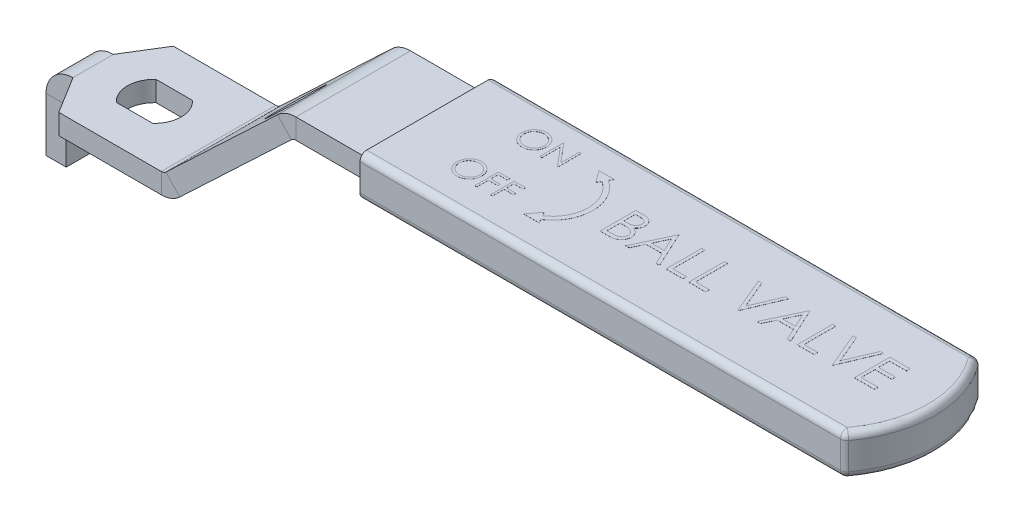
from build123d import *

# Parameters (mm, degrees)
BASE_FLANGE1_DEPTH  = 8.5
CUT_EXTRUDE1_DEPTH  = 119.863864273
SKETCH9_R           = 3.75
CUT_EXTRUDE2_DEPTH  = 135.74974064
BOSS_EXTRUDE1_DEPTH = 3
FILLET1_R           = 1
CUT_EXTRUDE3_DEPTH  = 124.020647419
BOSS_EXTRUDE2_DEPTH = 0.01


# Sheet-metal steps are written as plain solids
with BuildPart() as part:
    # Sketch5 → Base-Flange1 (new, symmetric)
    with BuildSketch(Plane.XY):
        with BuildLine():
            Line((117.334429005, 52.695), (34.924743548, 52.695))
            ThreePointArc((34.924743548, 52.695), (33.446942892, 52.412002182), (32.178249416, 51.60305261))
            Line((32.178249416, 51.60305261), (15.623473902, 35.967986847))
            ThreePointArc((15.623473902, 35.967986847), (15.306300534, 35.765749455), (14.93685037, 35.695))
            Line((14.93685037, 35.695), (-3.665570995, 35.695))
            ThreePointArc((-3.665570995, 35.695), (-6.49399812, 34.523427125), (-7.665570995, 31.695))
            Line((-7.665570995, 31.695), (-7.665570995, 23.695))
            Line((-7.665570995, 23.695), (-4.665570995, 23.695))
            Line((-4.665570995, 23.695), (-4.665570995, 31.695))
            ThreePointArc((-4.665570995, 31.695), (-4.372677776, 32.402106781), (-3.665570995, 32.695))
            Line((-3.665570995, 32.695), (14.93685037, 32.695))
            ThreePointArc((14.93685037, 32.695), (16.414651026, 32.977997818), (17.683344501, 33.78694739))
            Line((17.683344501, 33.78694739), (34.238120015, 49.422013153))
            ThreePointArc((34.238120015, 49.422013153), (34.555293384, 49.624250545), (34.924743548, 49.695))
            Line((34.924743548, 49.695), (117.334429005, 49.695))
            Line((117.334429005, 49.695), (117.334429005, 52.695))
        make_face()
    extrude(amount=BASE_FLANGE1_DEPTH, both=True)

    # Sketch8 → Cut-Extrude1 (cut, through all)
    with BuildSketch(Plane(origin=(0, 35.695, 0), x_dir=(1, 0, 0), z_dir=(0, 1, 0))):
        Polygon((-3.665570995, 3), (-8.383485137, 3), (-8.383485137, 8.5), (-0.269913787, 8.5), align=None)
        Polygon((-3.665570995, -3), (-8.383485137, -3), (-8.383485137, -8.5), (-0.269913787, -8.5), align=None)
    extrude(amount=-CUT_EXTRUDE1_DEPTH, mode=Mode.SUBTRACT)

    # Sketch9 → Cut-Extrude2 (cut, through all)
    with BuildSketch(Plane(origin=(-10.58893967, 11.211818474, 0), x_dir=(0.7270131525498175, 0.6866235329637166, 0), z_dir=(-0.6866235329637166, 0.7270131525498175, 0))):
        with Locations(Location((50.825880846, 0, 0), (0, 0, 180))):
            Circle(SKETCH9_R)
    extrude(amount=-CUT_EXTRUDE2_DEPTH, mode=Mode.SUBTRACT)

    # Sketch10 → Boss-Extrude1 (add, symmetric)
    with BuildSketch(Plane(origin=(0, 51.195, 0), x_dir=(1, 0, 0), z_dir=(0, 1, 0))):
        with BuildLine():
            Line((117.699853944, 10), (45.924743548, 10))
            Line((45.924743548, 10), (45.924743548, -10))
            Line((45.924743548, -10), (117.699853944, -10))
            ThreePointArc((117.699853944, -10), (121.209857947, 0), (117.699853944, 10))
        make_face()
    extrude(amount=BOSS_EXTRUDE1_DEPTH, both=True)

    # Fillet1
    fillet1_edges = [part.edges().sort_by_distance(p)[0] for p in [
        (121.209857947, 48.195, 0),
        (117.699853944, 51.195, 10),
        (81.812298746, 48.195, -10),
        (117.699853944, 51.195, -10),
        (45.924743548, 51.195, -10),
        (81.812298746, 54.195, 10),
        (121.209857947, 54.195, 0),
        (81.812298746, 54.195, -10),
        (81.812298746, 48.195, 10),
    ]]
    fillet(fillet1_edges, radius=FILLET1_R)

    # Sketch11 → Cut-Extrude3 (cut, through all)
    with BuildSketch(Plane(origin=(0, 35.695, 0), x_dir=(1, 0, 0), z_dir=(0, 1, 0))):
        with BuildLine():
            Line((2.71317371, 2.95), (8.115950773, 2.95))
            ThreePointArc((8.115950773, 2.95), (9.414562241, 0), (8.115950773, -2.95))
            Line((8.115950773, -2.95), (2.71317371, -2.95))
            ThreePointArc((2.71317371, -2.95), (1.414562241, 0), (2.71317371, 2.95))
        make_face()
    extrude(amount=-CUT_EXTRUDE3_DEPTH, mode=Mode.SUBTRACT)

    # Sketch12 → Boss-Extrude2 (add)
    # profile 1 of 15: a face of its own
    with BuildSketch(Plane(origin=(0, 54.195, 0), x_dir=(1, 0, 0), z_dir=(0, 1, 0))):
        with BuildLine():
            Line((67.09539703, 3.842426436), (67.420480273, 4.405487131))
            ThreePointArc((67.420480273, 4.405487131), (69.787084896, 0), (67.420480273, -4.405487131))
            Line((67.420480273, -4.405487131), (67.09539703, -3.842426436))
            Line((67.09539703, -3.842426436), (65.785995953, -5.574477244))
            Line((65.785995953, -5.574477244), (68.09539703, -5.574477244))
            Line((68.09539703, -5.574477244), (67.770313786, -5.011416549))
            ThreePointArc((67.770313786, -5.011416549), (70.485592084, 0), (67.770313786, 5.011416549))
            Line((67.770313786, 5.011416549), (68.09539703, 5.574477244))
            Line((68.09539703, 5.574477244), (65.785995953, 5.574477244))
            Line((65.785995953, 5.574477244), (67.09539703, 3.842426436))
        make_face()
    # profile 2 of 15: a face of its own
    with BuildSketch(Plane(origin=(0, 54.195, 0), x_dir=(1, 0, 0), z_dir=(0, 1, 0))):
        Polygon((59.604642791, 2.990312766), (59.604642791, 6.490312766), (59.67054824, 6.490312766), (61.98284792, 3.735605234), (61.98284792, 6.490312766), (62.296950484, 6.490312766), (62.296950484, 2.990312766), (62.225436061, 2.990312766), (59.918745356, 5.738710202), (59.918745356, 2.990312766), align=None)
    # profile 3 of 15: a face of its own
    with BuildSketch(Plane(origin=(0, 54.195, 0), x_dir=(1, 0, 0), z_dir=(0, 1, 0))):
        with BuildLine():
            add(Edge.make_bspline(
                [(57.024514586, 6.580056356), (57.089322692, 6.578414877), (57.216611159, 6.575190876), (57.403686057, 6.550511772), (57.582281152, 6.507816382), (57.753851291, 6.4509534), (57.916344268, 6.375099014), (58.07098316, 6.283413866), (58.217400034, 6.174937407), (58.353621415, 6.05050818), (58.478278366, 5.915124726), (58.588104252, 5.770646816), (58.680146546, 5.617948014), (58.755732333, 5.457487183), (58.815030943, 5.289627215), (58.855949986, 5.113473213), (58.882088136, 4.930166523), (58.885143914, 4.805139658), (58.886694074, 4.74171501)],
                knots=[0, 0, 0, 0, 1.065120563, 2.091984664, 3.0946048, 4.079830382, 5.057816894, 6.036188127, 7.030412546, 8.04752943, 9.064399622, 10.05169764, 11.02544977, 11.989514704, 12.962713494, 13.945757189, 14.957906945, 16, 16, 16, 16], degree=3))
            add(Edge.make_bspline(
                [(58.886694074, 4.74171501), (58.885144141, 4.678757563), (58.882089044, 4.554661143), (58.855920267, 4.372517699), (58.814879267, 4.197427002), (58.756283001, 4.02968135), (58.681057522, 3.869103786), (58.588402351, 3.716116832), (58.47926114, 3.570670333), (58.355054289, 3.434357668), (58.219653247, 3.309360198), (58.074422981, 3.200441322), (57.922629661, 3.106717197), (57.762319952, 3.031933523), (57.595619916, 2.972161603), (57.421037593, 2.931408973), (57.239391039, 2.90512193), (57.115520035, 2.902103414), (57.052559458, 2.900569176)],
                knots=[0, 0, 0, 0, 1.043624062, 2.057103931, 3.04512605, 4.022047818, 4.998200453, 5.980619268, 6.982898556, 8.009068085, 9.034988726, 10.034168286, 11.015286542, 11.987931943, 12.962482838, 13.94673481, 14.956375938, 16, 16, 16, 16], degree=3))
            add(Edge.make_bspline(
                [(57.052559458, 2.900569176), (56.989135139, 2.902118563), (56.864108923, 2.905172817), (56.680571888, 2.931354222), (56.504294144, 2.972295526), (56.335779793, 3.030804962), (56.174934863, 3.106422193), (56.021444781, 3.198626572), (55.875925633, 3.308033713), (55.739583887, 3.432200288), (55.614834689, 3.56737184), (55.506075313, 3.712206095), (55.4138502, 3.863861551), (55.338486867, 4.022759075), (55.278822408, 4.188130518), (55.23811759, 4.361078996), (55.211781638, 4.540618501), (55.208746791, 4.6628614), (55.207206894, 4.724888087)],
                knots=[0, 0, 0, 0, 1.053102029, 2.075944431, 3.073151272, 4.055350789, 5.033113405, 6.020478099, 7.024410459, 8.052272461, 9.079885166, 10.07527673, 11.055994387, 12.023226415, 12.992069828, 13.970394897, 14.97016774, 16, 16, 16, 16], degree=3))
            add(Edge.make_bspline(
                [(55.207206894, 4.724888087), (55.20774153, 4.766520756), (55.208804056, 4.849260879), (55.221595748, 4.972127479), (55.24015745, 5.093018137), (55.266759362, 5.211589085), (55.301551029, 5.32755007), (55.342603057, 5.441700833), (55.392742902, 5.552884556), (55.44942355, 5.661627948), (55.512685358, 5.766235854), (55.582561107, 5.865115437), (55.656596476, 5.959096434), (55.737759869, 6.045743438), (55.823376315, 6.127577094), (55.914834693, 6.203339811), (56.011576937, 6.273714762), (56.114019317, 6.337135103), (56.219637592, 6.394494238), (56.32851437, 6.443716089), (56.439170941, 6.48596215), (56.552125589, 6.520202976), (56.667078361, 6.547235012), (56.784280146, 6.565642365), (56.903637572, 6.578466683), (56.984048891, 6.579524185), (57.024514586, 6.580056356)],
                knots=[0, 0, 0, 0, 1.037015668, 2.060948919, 3.074880161, 4.083647147, 5.086022904, 6.090072063, 7.104153813, 8.122640571, 9.144368836, 10.147691507, 11.138137339, 12.123020368, 13.103399296, 14.087645067, 15.080126199, 16.082011238, 17.087798457, 18.072939717, 19.057185487, 20.037253025, 21.01195951, 21.997135196, 22.992090687, 24, 24, 24, 24], degree=3))
        make_face()
        with BuildLine():
            add(Edge.make_bspline(
                [(57.039939266, 6.221081997), (57.006724632, 6.220677107), (56.940612899, 6.219871197), (56.842328363, 6.209255481), (56.745336429, 6.194125592), (56.649617067, 6.172544072), (56.555570778, 6.143140019), (56.462320937, 6.109299111), (56.370717883, 6.06807802), (56.281064025, 6.021505316), (56.19414895, 5.969956395), (56.112136248, 5.912984628), (56.034813604, 5.851926074), (55.962370338, 5.786638236), (55.895019165, 5.716788634), (55.831434464, 5.643436198), (55.774164882, 5.564484307), (55.721679306, 5.4820739), (55.674711465, 5.396312319), (55.632946111, 5.308102457), (55.598782102, 5.21672477), (55.570919725, 5.123170613), (55.547819915, 5.027588153), (55.53318599, 4.929252304), (55.522453631, 4.828657192), (55.521693786, 4.760675338), (55.521309458, 4.72629033)],
                knots=[0, 0, 0, 0, 1.008559885, 2.007477868, 2.99961109, 3.989939068, 4.984837346, 5.991145699, 7.001802488, 8.033829008, 9.059044045, 10.069351652, 11.065060232, 12.050310815, 13.029377138, 14.011219647, 14.996725999, 15.989392538, 16.977580475, 17.965360261, 18.951710183, 19.937753436, 20.929683414, 21.935841486, 22.955955122, 24, 24, 24, 24], degree=3))
            add(Edge.make_bspline(
                [(55.521309458, 4.72629033), (55.52258432, 4.675728109), (55.525092368, 4.576256579), (55.547049938, 4.430488435), (55.580871913, 4.290400149), (55.630729279, 4.15675824), (55.693079894, 4.028413957), (55.770106784, 3.906505852), (55.861365869, 3.791000978), (55.965029396, 3.682705709), (56.078352103, 3.583859905), (56.198684833, 3.497096496), (56.32473844, 3.423686246), (56.456841643, 3.363881174), (56.594289182, 3.316491436), (56.737966733, 3.284012805), (56.886917192, 3.262637349), (56.988447848, 3.260584593), (57.039939266, 3.259543535)],
                knots=[0, 0, 0, 0, 1.032063989, 2.030389145, 3.003944642, 3.970395727, 4.937377036, 5.913328081, 6.909231446, 7.93887556, 8.970685674, 9.976071282, 10.964166581, 11.944589148, 12.933237628, 13.927779006, 14.949070134, 16, 16, 16, 16], degree=3))
            add(Edge.make_bspline(
                [(57.039939266, 3.259543535), (57.074548767, 3.26001904), (57.143189804, 3.260962108), (57.245285326, 3.270460785), (57.345541538, 3.285692654), (57.443817818, 3.30762331), (57.540002629, 3.335070516), (57.634497432, 3.367678244), (57.726295723, 3.408359448), (57.81655556, 3.453307399), (57.902951802, 3.504547557), (57.985427334, 3.559585706), (58.061903314, 3.620554327), (58.134292386, 3.68487214), (58.201920075, 3.753835988), (58.264329059, 3.827356209), (58.321309191, 3.905896867), (58.373774838, 3.988182272), (58.4205781, 4.074178525), (58.461357199, 4.162708203), (58.495953315, 4.253553312), (58.52388182, 4.346844884), (58.545767282, 4.442405733), (58.560847202, 4.540363811), (58.57139564, 4.640523153), (58.572190718, 4.708267009), (58.572591509, 4.742416132)],
                knots=[0, 0, 0, 0, 1.047197238, 2.076906641, 3.100256066, 4.114471768, 5.12198147, 6.126382909, 7.136867548, 8.15857795, 9.17633901, 10.174870724, 11.156907918, 12.133735059, 13.104061851, 14.077631395, 15.04955518, 16.038496417, 17.029181396, 18.010275684, 18.986308667, 19.968651475, 20.955262928, 21.950658345, 22.966943676, 24, 24, 24, 24], degree=3))
            add(Edge.make_bspline(
                [(58.572591509, 4.742416132), (58.572190396, 4.776331636), (58.571394715, 4.843609286), (58.56085224, 4.943070104), (58.54575135, 5.040323316), (58.523988642, 5.134987119), (58.495938488, 5.227085644), (58.461351158, 5.316532392), (58.420565858, 5.403660587), (58.373757634, 5.488254884), (58.32114181, 5.569429622), (58.263647567, 5.647032034), (58.200282219, 5.719604775), (58.132856194, 5.78893947), (58.059685309, 5.853557359), (57.981101015, 5.91347988), (57.898057337, 5.970153154), (57.810130102, 6.021278716), (57.719386148, 6.068492949), (57.62627219, 6.108943952), (57.53184309, 6.143316071), (57.436338978, 6.172633036), (57.338956, 6.194041066), (57.240352171, 6.209269116), (57.140663912, 6.219867502), (57.073620692, 6.220675881), (57.039939266, 6.221081997)],
                knots=[0, 0, 0, 0, 1.02996197, 2.043119294, 3.035359645, 4.018872909, 4.991431989, 5.957985074, 6.929999688, 7.912076566, 8.892894881, 9.867085534, 10.843653904, 11.817741046, 12.803660682, 13.806313499, 14.818574707, 15.856120519, 16.894564902, 17.924820532, 18.937903209, 19.946497019, 20.957711757, 21.963978472, 22.977135795, 24, 24, 24, 24], degree=3))
        make_face(mode=Mode.SUBTRACT)
    # profile 4 of 15: a face of its own
    with BuildSketch(Plane(origin=(0, 54.195, 0), x_dir=(1, 0, 0), z_dir=(0, 1, 0))):
        Polygon((60.861053048, -2.074477244), (62.566181253, -2.074477244), (62.566181253, -2.433451603), (61.175155612, -2.433451603), (61.175155612, -3.51037468), (62.566181253, -3.51037468), (62.566181253, -3.869349039), (61.175155612, -3.869349039), (61.175155612, -5.574477244), (60.861053048, -5.574477244), align=None)
    # profile 5 of 15: a face of its own
    with BuildSketch(Plane(origin=(0, 54.195, 0), x_dir=(1, 0, 0), z_dir=(0, 1, 0))):
        Polygon((58.527719715, -2.074477244), (60.23284792, -2.074477244), (60.23284792, -2.433451603), (58.841822279, -2.433451603), (58.841822279, -3.51037468), (60.23284792, -3.51037468), (60.23284792, -3.869349039), (58.841822279, -3.869349039), (58.841822279, -5.574477244), (58.527719715, -5.574477244), align=None)
    # profile 6 of 15: a face of its own
    with BuildSketch(Plane(origin=(0, 54.195, 0), x_dir=(1, 0, 0), z_dir=(0, 1, 0))):
        with BuildLine():
            add(Edge.make_bspline(
                [(55.947591509, -1.984733654), (56.012399615, -1.986375133), (56.139688082, -1.989599134), (56.32676298, -2.014278238), (56.505358075, -2.056973628), (56.676928214, -2.11383661), (56.839421191, -2.189690996), (56.994060083, -2.281376144), (57.140476957, -2.389852603), (57.276698339, -2.51428183), (57.401355289, -2.649665283), (57.511181175, -2.794143194), (57.603223469, -2.946841996), (57.678809256, -3.107302826), (57.738107866, -3.275162794), (57.779026909, -3.451316797), (57.80516506, -3.634623487), (57.808220837, -3.759650352), (57.809770997, -3.823075)],
                knots=[0, 0, 0, 0, 1.065120563, 2.091984664, 3.0946048, 4.079830382, 5.057816894, 6.036188127, 7.030412546, 8.04752943, 9.064399622, 10.05169764, 11.02544977, 11.989514704, 12.962713494, 13.945757189, 14.957906945, 16, 16, 16, 16], degree=3))
            add(Edge.make_bspline(
                [(57.809770997, -3.823075), (57.808221064, -3.886032446), (57.805165968, -4.010128867), (57.77899719, -4.192272311), (57.73795619, -4.367363008), (57.679359924, -4.53510866), (57.604134445, -4.695686224), (57.511479274, -4.848673178), (57.402338063, -4.994119676), (57.278131212, -5.130432342), (57.14273017, -5.255429812), (56.997499904, -5.364348688), (56.845706584, -5.458072813), (56.685396876, -5.532856486), (56.518696839, -5.592628407), (56.344114516, -5.633381037), (56.162467962, -5.65966808), (56.038596958, -5.662686596), (55.975636381, -5.664220833)],
                knots=[0, 0, 0, 0, 1.043624062, 2.057103931, 3.04512605, 4.022047818, 4.998200453, 5.980619268, 6.982898556, 8.009068085, 9.034988726, 10.034168286, 11.015286542, 11.987931943, 12.962482838, 13.94673481, 14.956375938, 16, 16, 16, 16], degree=3))
            add(Edge.make_bspline(
                [(55.975636381, -5.664220833), (55.912212062, -5.662671447), (55.787185846, -5.659617193), (55.603648811, -5.633435788), (55.427371067, -5.592494484), (55.258856716, -5.533985048), (55.098011786, -5.458367817), (54.944521704, -5.366163438), (54.799002556, -5.256756297), (54.66266081, -5.132589722), (54.537911612, -4.99741817), (54.429152236, -4.852583915), (54.336927123, -4.700928459), (54.26156379, -4.542030934), (54.201899331, -4.376659492), (54.161194513, -4.203711014), (54.134858561, -4.024171508), (54.131823714, -3.90192861), (54.130283817, -3.839901923)],
                knots=[0, 0, 0, 0, 1.053102029, 2.075944431, 3.073151272, 4.055350789, 5.033113405, 6.020478099, 7.024410459, 8.052272461, 9.079885166, 10.07527673, 11.055994387, 12.023226415, 12.992069828, 13.970394897, 14.97016774, 16, 16, 16, 16], degree=3))
            add(Edge.make_bspline(
                [(54.130283817, -3.839901923), (54.130818453, -3.798269254), (54.131880979, -3.715529131), (54.144672671, -3.59266253), (54.163234373, -3.471771873), (54.189836285, -3.353200925), (54.224627952, -3.23723994), (54.26567998, -3.123089177), (54.315819825, -3.011905453), (54.372500473, -2.903162062), (54.435762281, -2.798554156), (54.50563803, -2.699674573), (54.579673399, -2.605693576), (54.660836793, -2.519046572), (54.746453238, -2.437212916), (54.837911616, -2.361450199), (54.93465386, -2.291075248), (55.03709624, -2.227654907), (55.142714515, -2.170295772), (55.251591293, -2.121073921), (55.362247864, -2.078827859), (55.475202512, -2.044587034), (55.590155284, -2.017554998), (55.707357069, -1.999147645), (55.826714495, -1.986323327), (55.907125814, -1.985265825), (55.947591509, -1.984733654)],
                knots=[0, 0, 0, 0, 1.037015668, 2.060948919, 3.074880161, 4.083647147, 5.086022904, 6.090072063, 7.104153813, 8.122640571, 9.144368836, 10.147691507, 11.138137339, 12.123020368, 13.103399296, 14.087645067, 15.080126199, 16.082011238, 17.087798457, 18.072939717, 19.057185487, 20.037253025, 21.01195951, 21.997135196, 22.992090687, 24, 24, 24, 24], degree=3))
        make_face()
        with BuildLine():
            add(Edge.make_bspline(
                [(55.963016189, -2.343708013), (55.929801555, -2.344112903), (55.863689822, -2.344918813), (55.765405286, -2.355534528), (55.668413352, -2.370664417), (55.57269399, -2.392245938), (55.478647701, -2.421649991), (55.38539786, -2.455490899), (55.293794806, -2.49671199), (55.204140948, -2.543284694), (55.117225873, -2.594833615), (55.035213171, -2.651805382), (54.957890527, -2.712863936), (54.885447261, -2.778151774), (54.818096089, -2.848001375), (54.754511387, -2.921353811), (54.697241805, -3.000305703), (54.644756229, -3.082716109), (54.597788388, -3.168477691), (54.556023034, -3.256687553), (54.521859025, -3.34806524), (54.493996649, -3.441619397), (54.470896838, -3.537201857), (54.456262914, -3.635537706), (54.445530554, -3.736132818), (54.444770709, -3.804114672), (54.444386381, -3.83849968)],
                knots=[0, 0, 0, 0, 1.008559885, 2.007477868, 2.99961109, 3.989939068, 4.984837346, 5.991145699, 7.001802488, 8.033829008, 9.059044045, 10.069351652, 11.065060232, 12.050310815, 13.029377138, 14.011219647, 14.996725999, 15.989392538, 16.977580475, 17.965360261, 18.951710183, 19.937753436, 20.929683414, 21.935841486, 22.955955122, 24, 24, 24, 24], degree=3))
            add(Edge.make_bspline(
                [(54.444386381, -3.83849968), (54.445661243, -3.8890619), (54.448169291, -3.988533431), (54.470126861, -4.134301575), (54.503948836, -4.274389861), (54.553806202, -4.40803177), (54.616156817, -4.536376053), (54.693183707, -4.658284158), (54.784442793, -4.773789032), (54.888106319, -4.882084301), (55.001429026, -4.980930105), (55.121761756, -5.067693514), (55.247815363, -5.141103764), (55.379918566, -5.200908836), (55.517366105, -5.248298574), (55.661043656, -5.280777205), (55.809994116, -5.30215266), (55.911524771, -5.304205416), (55.963016189, -5.305246474)],
                knots=[0, 0, 0, 0, 1.032063989, 2.030389145, 3.003944642, 3.970395727, 4.937377036, 5.913328081, 6.909231446, 7.93887556, 8.970685674, 9.976071282, 10.964166581, 11.944589148, 12.933237628, 13.927779006, 14.949070134, 16, 16, 16, 16], degree=3))
            add(Edge.make_bspline(
                [(55.963016189, -5.305246474), (55.997625691, -5.30477097), (56.066266727, -5.303827902), (56.168362249, -5.294329225), (56.268618461, -5.279097356), (56.366894741, -5.2571667), (56.463079552, -5.229719494), (56.557574355, -5.197111766), (56.649372646, -5.156430562), (56.739632483, -5.111482611), (56.826028725, -5.060242453), (56.908504257, -5.005204303), (56.984980237, -4.944235683), (57.057369309, -4.87991787), (57.124996998, -4.810954022), (57.187405982, -4.7374338), (57.244386114, -4.658893143), (57.296851761, -4.576607737), (57.343655023, -4.490611485), (57.384434123, -4.402081807), (57.419030238, -4.311236697), (57.446958743, -4.217945126), (57.468844205, -4.122384277), (57.483924125, -4.024426199), (57.494472563, -3.924266857), (57.495267641, -3.856523001), (57.495668433, -3.822373878)],
                knots=[0, 0, 0, 0, 1.047197238, 2.076906641, 3.100256066, 4.114471768, 5.12198147, 6.126382909, 7.136867548, 8.15857795, 9.17633901, 10.174870724, 11.156907918, 12.133735059, 13.104061851, 14.077631395, 15.04955518, 16.038496417, 17.029181396, 18.010275684, 18.986308667, 19.968651475, 20.955262928, 21.950658345, 22.966943676, 24, 24, 24, 24], degree=3))
            add(Edge.make_bspline(
                [(57.495668433, -3.822373878), (57.49526732, -3.788458374), (57.494471638, -3.721180724), (57.483929163, -3.621719905), (57.468828273, -3.524466694), (57.447065565, -3.429802891), (57.419015411, -3.337704366), (57.384428081, -3.248257618), (57.343642781, -3.161129423), (57.296834557, -3.076535126), (57.244218734, -2.995360388), (57.18672449, -2.917757976), (57.123359142, -2.845185234), (57.055933117, -2.77585054), (56.982762232, -2.711232651), (56.904177938, -2.65131013), (56.82113426, -2.594636856), (56.733207025, -2.543511294), (56.642463071, -2.496297061), (56.549349113, -2.455846058), (56.454920013, -2.421473939), (56.359415901, -2.392156974), (56.262032923, -2.370748943), (56.163429094, -2.355520894), (56.063740835, -2.344922508), (55.996697616, -2.344114129), (55.963016189, -2.343708013)],
                knots=[0, 0, 0, 0, 1.02996197, 2.043119294, 3.035359645, 4.018872909, 4.991431989, 5.957985074, 6.929999688, 7.912076566, 8.892894881, 9.867085534, 10.843653904, 11.817741046, 12.803660682, 13.806313499, 14.818574707, 15.856120519, 16.894564902, 17.924820532, 18.937903209, 19.946497019, 20.957711757, 21.963978472, 22.977135795, 24, 24, 24, 24], degree=3))
        make_face(mode=Mode.SUBTRACT)
    # profile 7 of 15: a face of its own
    with BuildSketch(Plane(origin=(0, 54.195, 0), x_dir=(1, 0, 0), z_dir=(0, 1, 0))):
        with BuildLine():
            Line((73.646704596, 3.200636404), (74.679173212, 3.200636404))
            add(Edge.make_bspline(
                [(74.679173212, 3.200636404), (74.729713887, 3.200370686), (74.827674295, 3.199855659), (74.970125117, 3.191868068), (75.103548914, 3.180976805), (75.22798438, 3.163695593), (75.343374013, 3.14284374), (75.45006556, 3.117592185), (75.547719749, 3.087313852), (75.664306862, 3.039165308), (75.797234528, 2.967617184), (75.941165431, 2.861891854), (76.064240889, 2.732574915), (76.170355916, 2.586702329), (76.254721894, 2.42623515), (76.315756427, 2.254998044), (76.354397501, 2.075199696), (76.358371443, 1.951762986), (76.360379809, 1.889380061)],
                knots=[0, 0, 0, 0, 1.001505555, 1.941167018, 2.826882275, 3.653841531, 4.429895133, 5.150066043, 5.825578002, 6.45369114, 7.647487171, 8.808567382, 9.977351308, 11.170798116, 12.373658725, 13.556498008, 14.765093433, 16, 16, 16, 16], degree=3))
            add(Edge.make_bspline(
                [(76.360379809, 1.889380061), (76.358726967, 1.830941078), (76.355478976, 1.716102965), (76.324420281, 1.548139252), (76.275796413, 1.388253481), (76.208206334, 1.23702916), (76.120361649, 1.097883102), (76.016254429, 0.969692831), (75.890650216, 0.857885875), (75.796544365, 0.795379344), (75.748742857, 0.763628859)],
                knots=[0, 0, 0, 0, 1.044552857, 2.05264487, 3.044412934, 4.028983338, 5.005914585, 5.980388656, 6.974128949, 8, 8, 8, 8], degree=3))
            add(Edge.make_bspline(
                [(75.748742857, 0.763628859), (75.808856837, 0.740549634), (75.923869771, 0.69639336), (76.082145052, 0.618325456), (76.218511068, 0.533413694), (76.334016276, 0.440685778), (76.432800588, 0.340735552), (76.519059202, 0.232097463), (76.592660804, 0.113354341), (76.655726771, -0.014255766), (76.704937391, -0.149429832), (76.741791436, -0.290899934), (76.762908889, -0.438158785), (76.765914014, -0.538375966), (76.767431091, -0.588968631)],
                knots=[0, 0, 0, 0, 1.27268992, 2.434971085, 3.483601985, 4.442670788, 5.356604649, 6.2567628, 7.179492994, 8.113709626, 9.066344395, 10.018646069, 10.999752585, 12, 12, 12, 12], degree=3))
            add(Edge.make_bspline(
                [(76.767431091, -0.588968631), (76.765954193, -0.640625687), (76.763048355, -0.742262394), (76.741609588, -0.891570752), (76.705310105, -1.034256683), (76.655309681, -1.17124309), (76.590052372, -1.30226496), (76.510635092, -1.427470728), (76.415942133, -1.545602395), (76.310013748, -1.657972634), (76.190176933, -1.759009884), (76.060885256, -1.848991965), (75.920510463, -1.922993749), (75.771358043, -1.985157258), (75.611754851, -2.032641951), (75.442417575, -2.06586239), (75.263492262, -2.088246196), (75.140710852, -2.090086494), (75.077744259, -2.091030263)],
                knots=[0, 0, 0, 0, 0.978564426, 1.925352924, 2.850884081, 3.763762016, 4.682927383, 5.618979971, 6.567305752, 7.547517671, 8.540179244, 9.531824382, 10.526200242, 11.540722885, 12.589160233, 13.674978461, 14.80764778, 16, 16, 16, 16], degree=3))
            Line((75.077744259, -2.091030263), (73.646704596, -2.091030263))
            Line((73.646704596, -2.091030263), (73.646704596, 3.200636404))
        make_face()
        with BuildLine():
            Line((74.121597758, 2.657901361), (74.121597758, 0.961854353))
            Line((74.121597758, 0.961854353), (74.440666601, 0.961854353))
            add(Edge.make_bspline(
                [(74.440666601, 0.961854353), (74.487307042, 0.962458998), (74.577425878, 0.963627297), (74.707933341, 0.966973924), (74.829074737, 0.976344775), (74.940640961, 0.985712933), (75.042456323, 1.00094475), (75.134295256, 1.019075698), (75.217599087, 1.038251042), (75.313664829, 1.070862052), (75.422632263, 1.119058061), (75.538796599, 1.193854766), (75.641204666, 1.282942776), (75.727681366, 1.385738635), (75.798455852, 1.498929178), (75.847613492, 1.62070839), (75.880946886, 1.748041209), (75.883957892, 1.8354569), (75.885486647, 1.879839796)],
                knots=[0, 0, 0, 0, 1.156816544, 2.235205308, 3.236616184, 4.169592532, 5.011045266, 5.787822928, 6.49130361, 7.128639758, 8.301311294, 9.436451833, 10.541879658, 11.654887649, 12.756523258, 13.837046038, 14.901820046, 16, 16, 16, 16], degree=3))
            add(Edge.make_bspline(
                [(75.885486647, 1.879839796), (75.884691112, 1.909209713), (75.883130585, 1.966822011), (75.870349997, 2.050807344), (75.848627592, 2.129794922), (75.820726459, 2.204867208), (75.781736417, 2.273676791), (75.735829753, 2.338602813), (75.680364483, 2.39743423), (75.617231403, 2.452421448), (75.544646937, 2.501172103), (75.462654389, 2.543869448), (75.370144449, 2.578251336), (75.268676204, 2.608362662), (75.156687774, 2.62951163), (75.035471485, 2.647130442), (74.904034469, 2.656100183), (74.813100802, 2.657287577), (74.766095621, 2.657901361)],
                knots=[0, 0, 0, 0, 0.91205012, 1.789085906, 2.630437955, 3.453916878, 4.269457761, 5.079663411, 5.91843418, 6.774407191, 7.675494373, 8.627863946, 9.638891023, 10.736472738, 11.911756761, 13.175263542, 14.539845004, 16, 16, 16, 16], degree=3))
            Line((74.766095621, 2.657901361), (74.121597758, 2.657901361))
        make_face(mode=Mode.SUBTRACT)
        with BuildLine():
            Line((74.121597758, 0.41911931), (74.121597758, -1.54829522))
            Line((74.121597758, -1.54829522), (74.797896503, -1.54829522))
            add(Edge.make_bspline(
                [(74.797896503, -1.54829522), (74.846306069, -1.54771503), (74.939609127, -1.546596792), (75.074321701, -1.542946215), (75.199179489, -1.534642417), (75.313612742, -1.521570716), (75.418857116, -1.507391394), (75.513650072, -1.488324338), (75.598760019, -1.466478886), (75.697448556, -1.432711745), (75.80857886, -1.380253985), (75.928338131, -1.301159857), (76.034815866, -1.206932951), (76.125235722, -1.097877879), (76.199338693, -0.979297182), (76.253246345, -0.853589332), (76.286494426, -0.722831451), (76.290519373, -0.633679397), (76.292537929, -0.588968631)],
                knots=[0, 0, 0, 0, 1.160039823, 2.235823828, 3.228722157, 4.157150951, 4.99529583, 5.772374946, 6.472645482, 7.099169577, 8.269452708, 9.405989375, 10.527446681, 11.663510218, 12.788923519, 13.866172445, 14.929861265, 16, 16, 16, 16], degree=3))
            add(Edge.make_bspline(
                [(76.292537929, -0.588968631), (76.292120485, -0.561008461), (76.291292332, -0.505539122), (76.278803069, -0.424023538), (76.260639242, -0.345062992), (76.237157193, -0.268443074), (76.202958713, -0.195549041), (76.163034532, -0.124939219), (76.116223841, -0.056520268), (76.043283257, 0.02997921), (75.9371899, 0.129639456), (75.786442751, 0.227214013), (75.615034634, 0.305905341), (75.490714496, 0.339317644), (75.426493925, 0.356577577)],
                knots=[0, 0, 0, 0, 0.723448775, 1.435228256, 2.130040452, 2.821711965, 3.505591119, 4.210454504, 4.921174351, 5.648778258, 7.137944449, 8.670945889, 10.280296675, 12, 12, 12, 12], degree=3))
            add(Edge.make_bspline(
                [(75.426493925, 0.356577577), (75.400747554, 0.361801334), (75.344924111, 0.373127519), (75.253895983, 0.385083213), (75.149973896, 0.395734673), (75.032917879, 0.403613447), (74.902579834, 0.411757388), (74.758681397, 0.414924558), (74.601810219, 0.418703201), (74.492964608, 0.418977059), (74.436426484, 0.41911931)],
                knots=[0, 0, 0, 0, 0.634451884, 1.375622551, 2.216452059, 3.157844607, 4.20941857, 5.370758133, 6.634282058, 8, 8, 8, 8], degree=3))
            Line((74.436426484, 0.41911931), (74.121597758, 0.41911931))
        make_face(mode=Mode.SUBTRACT)
    # profile 8 of 15: a face of its own
    with BuildSketch(Plane(origin=(0, 54.195, 0), x_dir=(1, 0, 0), z_dir=(0, 1, 0))):
        Polygon((80.023841348, 3.200636404), (82.46614904, -2.091030263), (81.949914732, -2.091030263), (81.167613049, -0.394983254), (78.768766561, -0.394983254), (77.964204262, -2.091030263), (77.445849895, -2.091030263), (79.955999467, 3.200636404), align=None)
        Polygon((79.984620261, 2.169227817), (79.026353701, 0.147751789), (80.917446115, 0.147751789), align=None, mode=Mode.SUBTRACT)
    # profile 9 of 15: a face of its own
    with BuildSketch(Plane(origin=(0, 54.195, 0), x_dir=(1, 0, 0), z_dir=(0, 1, 0))):
        Polygon((83.415935365, 3.200636404), (83.890828527, 3.200636404), (83.890828527, -1.54829522), (85.926084937, -1.54829522), (85.926084937, -2.091030263), (83.415935365, -2.091030263), align=None)
    # profile 10 of 15: a face of its own
    with BuildSketch(Plane(origin=(0, 54.195, 0), x_dir=(1, 0, 0), z_dir=(0, 1, 0))):
        Polygon((86.808029382, 3.200636404), (87.282922544, 3.200636404), (87.282922544, -1.54829522), (89.318178955, -1.54829522), (89.318178955, -2.091030263), (86.808029382, -2.091030263), align=None)
    # profile 11 of 15: a face of its own
    with BuildSketch(Plane(origin=(0, 54.195, 0), x_dir=(1, 0, 0), z_dir=(0, 1, 0))):
        Polygon((91.828328527, 3.200636404), (92.33714263, 3.200636404), (94.101031519, -0.969519178), (95.864920407, 3.200636404), (96.37373451, 3.200636404), (94.134952459, -2.091030263), (94.067110578, -2.091030263), align=None)
    # profile 12 of 15: a face of its own
    with BuildSketch(Plane(origin=(0, 54.195, 0), x_dir=(1, 0, 0), z_dir=(0, 1, 0))):
        Polygon((99.494461006, 3.200636404), (101.936768698, -2.091030263), (101.42053439, -2.091030263), (100.638232707, -0.394983254), (98.239386219, -0.394983254), (97.43482392, -2.091030263), (96.916469553, -2.091030263), (99.426619125, 3.200636404), align=None)
        Polygon((99.455239919, 2.169227817), (98.496973359, 0.147751789), (100.388065773, 0.147751789), align=None, mode=Mode.SUBTRACT)
    # profile 13 of 15: a face of its own
    with BuildSketch(Plane(origin=(0, 54.195, 0), x_dir=(1, 0, 0), z_dir=(0, 1, 0))):
        Polygon((102.886555023, 3.200636404), (103.361448185, 3.200636404), (103.361448185, -1.54829522), (105.396704596, -1.54829522), (105.396704596, -2.091030263), (102.886555023, -2.091030263), align=None)
    # profile 14 of 15: a face of its own
    with BuildSketch(Plane(origin=(0, 54.195, 0), x_dir=(1, 0, 0), z_dir=(0, 1, 0))):
        Polygon((105.871597758, 3.200636404), (106.38041186, 3.200636404), (108.144300749, -0.969519178), (109.908189638, 3.200636404), (110.417003741, 3.200636404), (108.17822169, -2.091030263), (108.110379809, -2.091030263), align=None)
    # profile 15 of 15: a face of its own
    with BuildSketch(Plane(origin=(0, 54.195, 0), x_dir=(1, 0, 0), z_dir=(0, 1, 0))):
        Polygon((111.366790066, 3.200636404), (114.351832801, 3.200636404), (114.351832801, 2.657901361), (111.841683228, 2.657901361), (111.841683228, 1.029696233), (114.351832801, 1.029696233), (114.351832801, 0.48696119), (111.841683228, 0.48696119), (111.841683228, -1.54829522), (114.351832801, -1.54829522), (114.351832801, -2.091030263), (111.366790066, -2.091030263), align=None)
    extrude(amount=BOSS_EXTRUDE2_DEPTH)


solid = part.part
